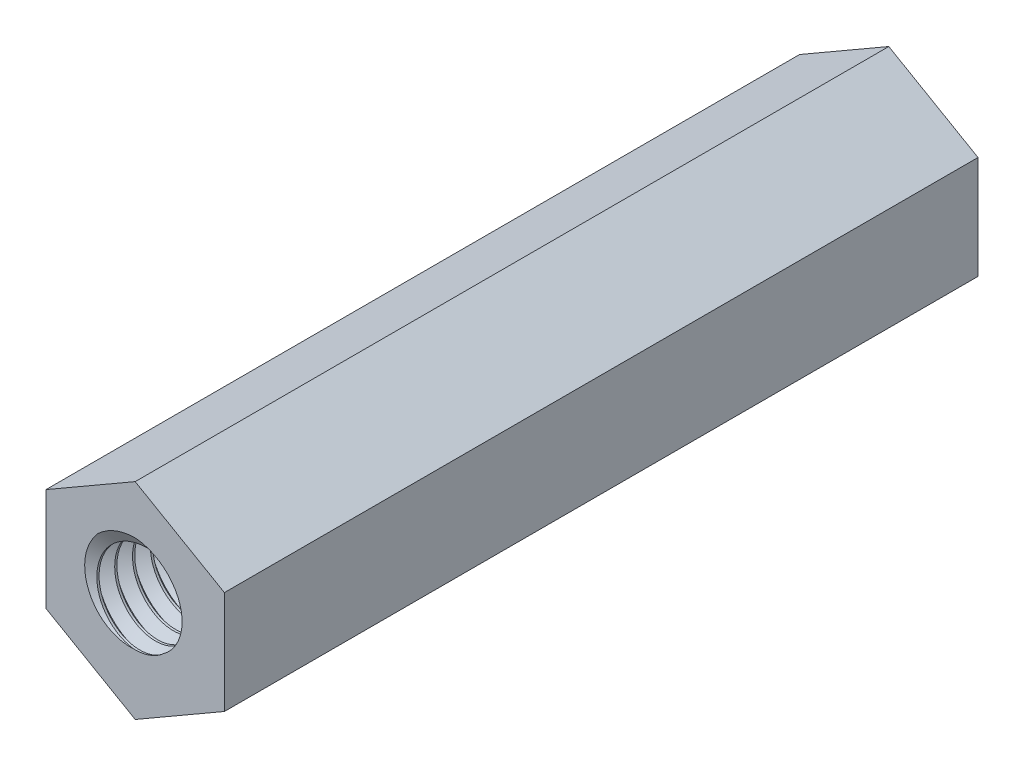
from build123d import *

# Parameters (mm, degrees)
EXTRUDE1_DEPTH          = 22.225
EXTRUDE1_DEPTH_BACK     = 22.225
SKETCH1_R               = 2.413
SWEEP1_PITCH            = 0.79375
EXTRUDE2_DEPTH          = 46.648273531
SKETCH8_OUTSIDE_W       = 180.9
SKETCH8_OUTSIDE_H       = 182.128
SKETCH8_OUTSIDE_R       = 3.96875
EXTRUDE4_DEPTH          = 46.648273531
EXTRUDE4_DRAFT          = -60
MIRROR1_COPY_1_SKETCH_W = 180.9
MIRROR1_COPY_1_SKETCH_H = 182.128
MIRROR1_COPY_1_SKETCH_R = 3.96875
MIRROR1_COPY_1_DEPTH    = 46.648273531
MIRROR1_COPY_1_DRAFT    = -60
SKETCH9_W               = 19.05
SKETCH9_H               = 2.4638
SKETCH14_R              = 4.766616802
CUT_EXTRUDE1_DEPTH      = 5.46


with BuildPart() as part:
    # Sketch1 → Extrude1 (new, two sides: drawn at the far end of the back side and taken through both)
    with BuildSketch(Plane.XY.offset(-EXTRUDE1_DEPTH_BACK)):
        Polygon((0, 4.582717762), (-3.96875, 2.291358881), (-3.96875, -2.291358881), (0, -4.582717762), (3.96875, -2.291358881), (3.96875, 2.291358881), align=None)
        Circle(SKETCH1_R, mode=Mode.SUBTRACT)
    extrude(amount=EXTRUDE1_DEPTH + EXTRUDE1_DEPTH_BACK)

    # Sweep1: arcs per turn and ends read off the stored shape
    # Sweep1: the profile of Sketch12 profile screwed along a right-hand helix through 57 turns, 6 arcs to a turn; built about Z, then put on its axis
    sweep1_z = Axis((0, 0, 0), (0, 0, 1))
    sweep1_corners = [(2.4133, 0, -0.694704455), (2.4133, 0, 0.000173205), (1.897444252, 0, -0.29765625), (1.897444252, 0, -0.396875)]
    with BuildLine(mode=Mode.PRIVATE) as sweep1_profile:
        Line(sweep1_corners[0], sweep1_corners[1])
        Line(sweep1_corners[1], sweep1_corners[2])
        Line(sweep1_corners[2], sweep1_corners[3])
        Line(sweep1_corners[3], sweep1_corners[0])
    sweep1_cap = Face(sweep1_profile.wire())
    sweep1_turn_angles = [0, 30, 60, 90, 120, 150, 180, 210, 240, 270, 300, 330, 360]
    sweep1_turn_weights = [1, 0.8660254037844387, 1, 0.8660254037844387, 1, 0.8660254037844387, 1, 0.8660254037844387, 1, 0.8660254037844387, 1, 0.8660254037844387, 1]
    sweep1_turn_rails = [Edge.make_bspline([Vector(p[0], p[1], 0).rotate(sweep1_z, sweep1_turn_angles[k]) / sweep1_turn_weights[k] + Vector(0, 0, p[2] + SWEEP1_PITCH * sweep1_turn_angles[k] / 360) for k in range(13)], [0, 0, 0, 1, 1, 2, 2, 3, 3, 4, 4, 5, 5, 6, 6, 6], 2, sweep1_turn_weights) for p in sweep1_corners]
    sweep1_turn_sides = [Face.make_surface_from_curves(sweep1_turn_rails[p[0]], sweep1_turn_rails[p[1]]) for p in [(0, 1), (1, 2), (2, 3), (3, 0)]]
    sweep1 = Plane(origin=(0, 0, -22.225), x_dir=(0, 1, 0), z_dir=(0, 0, 1)) * Solid(Shell([*[p.moved(Location((0, 0, SWEEP1_PITCH * i))) for i in range(57) for p in sweep1_turn_sides], sweep1_cap, sweep1_cap.rotate(sweep1_z, 20520).moved(Location((0, 0, SWEEP1_PITCH * 20520 / 360)))]))
    add(sweep1)

    # Sketch6 → Extrude2 (cut, through all)
    with BuildSketch(Plane(origin=(0, 0, -22.225), x_dir=(-1, 0, 0), z_dir=(0, 0, -1))):
        Polygon((0, 4.582717762), (-3.96875, 2.291358881), (-3.96875, -2.291358881), (0, -4.582717762), (3.96875, -2.291358881), (3.96875, 2.291358881), align=None)
    extrude2 = extrude(amount=EXTRUDE2_DEPTH, mode=Mode.SUBTRACT)

    # Extrude3 cone 1 section (through the dimple's axis) → Extrude3 (revolve, cut)
    with BuildSketch(Plane(origin=(0, 0, -22.225), x_dir=(0, 1, 0), z_dir=(1, 0, 0))):
        Polygon((0, 0), (2.4638, 0), (0, 2.642102028), align=None)
    extrude3 = revolve(axis=Axis((0, 0, -22.225), (0, 0, 1)), mode=Mode.SUBTRACT)


with BuildPart() as extrude4_tool:
    # Sketch8 outside → Extrude4 (with draft: the straight prism first)
    with BuildSketch(Plane(origin=(0, 0, -22.225), x_dir=(-1, 0, 0), z_dir=(0, 0, -1))):
        Rectangle(SKETCH8_OUTSIDE_W, SKETCH8_OUTSIDE_H)
        Circle(SKETCH8_OUTSIDE_R, mode=Mode.SUBTRACT)
    extrude(amount=-EXTRUDE4_DEPTH)
    # Extrude4: the draft: its side faces are tilted about the plane it starts from
    extrude4_sides = [extrude4_tool.faces().sort_by_distance(p)[0] for p in [
        (0, -91.064, 1.099136766),
        (-90.45, 0, 1.099136766),
        (0, 91.064, 1.099136766),
        (90.45, 0, 1.099136766),
        (3.96875, 0, 1.099136766),
    ]]
    draft(extrude4_sides, Plane(origin=(0, 0, -22.225), x_dir=(-1, 0, 0), z_dir=(0, 0, -1)), EXTRUDE4_DRAFT)


with BuildPart() as part_1:
    add(part.part)

    # Extrude4: cut by extrude4_tool
    add(extrude4_tool.part, mode=Mode.SUBTRACT)

    # Mirror1: Extrude2, Extrude3 across plane
    add(extrude2.mirror(Plane.XY), mode=Mode.SUBTRACT)
    add(extrude3.mirror(Plane.XY), mode=Mode.SUBTRACT)


with BuildPart() as mirror1_copy_1_tool:
    # Mirror1 copy 1 sketch → Mirror1 copy 1 (with draft: the straight prism first)
    with BuildSketch(Plane(origin=(0, 0, 22.225), x_dir=(-1, 0, 0), z_dir=(0, 0, 1))):
        Rectangle(MIRROR1_COPY_1_SKETCH_W, MIRROR1_COPY_1_SKETCH_H)
        Circle(MIRROR1_COPY_1_SKETCH_R, mode=Mode.SUBTRACT)
    extrude(amount=-MIRROR1_COPY_1_DEPTH)
    # Mirror1 copy 1: the draft: its side faces are tilted about the plane it starts from
    mirror1_copy_1_sides = [mirror1_copy_1_tool.faces().sort_by_distance(p)[0] for p in [
        (0, -91.064, -1.099136766),
        (-90.45, 0, -1.099136766),
        (0, 91.064, -1.099136766),
        (90.45, 0, -1.099136766),
        (3.96875, 0, -1.099136766),
    ]]
    draft(mirror1_copy_1_sides, Plane(origin=(0, 0, 22.225), x_dir=(-1, 0, 0), z_dir=(0, 0, 1)), MIRROR1_COPY_1_DRAFT)


with BuildPart() as part_2:
    add(part_1.part)

    # Mirror1 copy 1: cut by mirror1_copy_1_tool
    add(mirror1_copy_1_tool.part, mode=Mode.SUBTRACT)

    # Sketch9 → Revolve 2 (revolve)
    with BuildSketch(Plane(origin=(0, 0, 0), x_dir=(0, 0, -1), z_dir=(1, 0, 0))):
        with Locations((0, 1.2319)):
            Rectangle(SKETCH9_W, SKETCH9_H)
    revolve(axis=Axis((0, 0, 22.225), (0, 0, -1)))

    # Sketch14 → Cut-Extrude1 (cut)
    with BuildSketch(Plane.XY.offset(22.225)):
        Circle(SKETCH14_R)
    cut_extrude1 = extrude(amount=-CUT_EXTRUDE1_DEPTH, mode=Mode.SUBTRACT)

    # Mirror2: Cut-Extrude1 across plane
    add(cut_extrude1.mirror(Plane.XY), mode=Mode.SUBTRACT)


solid = part_2.part
